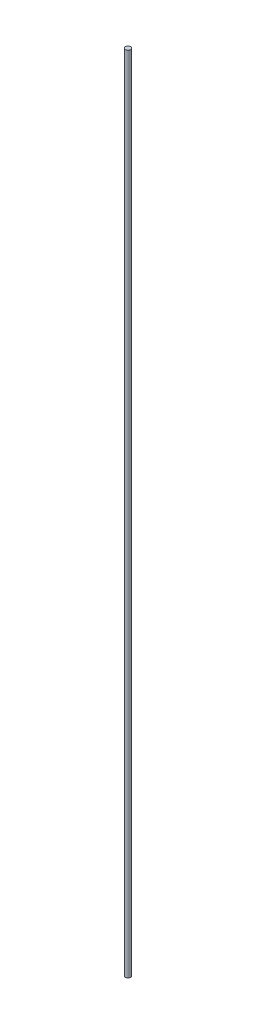
from build123d import *

# Parameters (mm, degrees)
SWEEP1_PROFILE_R = 6.35


with BuildPart() as part:
    # Sweep1: sweep along a path in Sketch1
    with BuildLine(Plane.XY) as sweep1_path:
        Line((0, 0), (0, 1949.196))
    # Sweep1 profile (on start of the path) → Sweep1 (sweep)
    with BuildSketch(Plane.ZX):
        Circle(SWEEP1_PROFILE_R)
    sweep(path=sweep1_path.line)


solid = part.part
